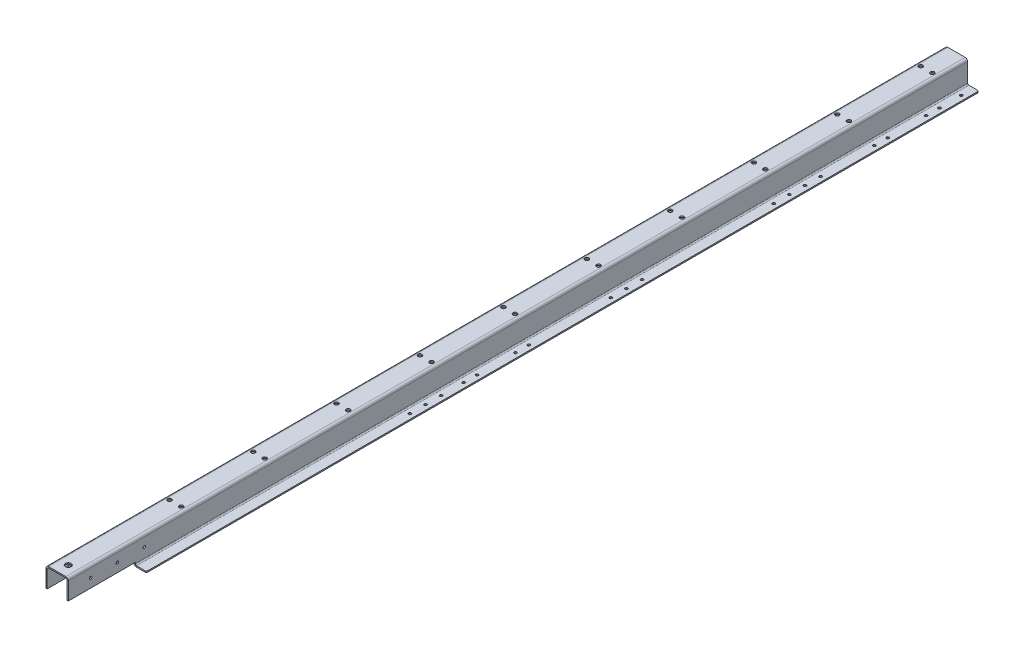
from build123d import *

# Parameters (mm, degrees)
BASE_FLANGE1_DEPTH  = 2015
SKETCH10_W          = 100
SKETCH10_H          = 150
CUT_EXTRUDE4_DEPTH  = 8
CUT_EXTRUDE5_REACH  = 2018.312
SKETCH11_R          = 4.5
SKETCH11_R_2        = 6.5
CUT_EXTRUDE6_REACH  = 2019.015
SKETCH12_R          = 3
CUT_EXTRUDE8_REACH  = 2018.24
SKETCH14_R          = 3
CUT_EXTRUDE9_REACH  = 2018.24
SKETCH15_R          = 3
FILLET1_R           = 3
CUT_EXTRUDE10_REACH = 2018.24
SKETCH17_R          = 3


# Sheet-metal steps are written as plain solids
with BuildPart() as part:
    # Sketch1 → Base-Flange1 (new body)
    with BuildSketch(Plane.XY):
        with BuildLine():
            Line((-50, 0), (-27.8, 0))
            ThreePointArc((-27.8, 0), (-25.820101013, 0.820101013), (-25, 2.8))
            Line((-25, 2.8), (-25, 44.4))
            ThreePointArc((-25, 44.4), (-23.359797975, 48.359797975), (-19.4, 50))
            Line((-19.4, 50), (19.4, 50))
            ThreePointArc((19.4, 50), (23.359797975, 48.359797975), (25, 44.4))
            Line((25, 44.4), (25, 2.8))
            ThreePointArc((25, 2.8), (25.820101013, 0.820101013), (27.8, 0))
            Line((27.8, 0), (50, 0))
            Line((50, 0), (50, -2.8))
            Line((50, -2.8), (27.8, -2.8))
            ThreePointArc((27.8, -2.8), (23.840202025, -1.159797975), (22.2, 2.8))
            Line((22.2, 2.8), (22.2, 44.4))
            ThreePointArc((22.2, 44.4), (21.379898987, 46.379898987), (19.4, 47.2))
            Line((19.4, 47.2), (-19.4, 47.2))
            ThreePointArc((-19.4, 47.2), (-21.379898987, 46.379898987), (-22.2, 44.4))
            Line((-22.2, 44.4), (-22.2, 2.8))
            ThreePointArc((-22.2, 2.8), (-23.840202025, -1.159797975), (-27.8, -2.8))
            Line((-27.8, -2.8), (-50, -2.8))
            Line((-50, -2.8), (-50, 0))
        make_face()
    extrude(amount=BASE_FLANGE1_DEPTH)

    # Sketch10 → Cut-Extrude4 (cut)
    with BuildSketch(Plane.XZ.offset(2.8)):
        with Locations((0, 1940)):
            Rectangle(SKETCH10_W, SKETCH10_H)
    extrude(amount=-CUT_EXTRUDE4_DEPTH, mode=Mode.SUBTRACT)

    # Sketch11 → Cut-Extrude5 (cut, up to next)
    with BuildSketch(Plane(origin=(0, 50, 0), x_dir=(1, 0, 0), z_dir=(0, 1, 0)), mode=Mode.PRIVATE) as cut_extrude5_sk1:
        with Locations(Location((13, -67, 0), (0, 0, 270))):
            Circle(SKETCH11_R)
    cut_extrude5_tool1 = extrude(cut_extrude5_sk1.sketch, amount=-CUT_EXTRUDE5_REACH, mode=Mode.PRIVATE) & part.part
    # Sketch11 → Cut-Extrude5 (cut, up to next)
    with BuildSketch(Plane(origin=(0, 50, 0), x_dir=(1, 0, 0), z_dir=(0, 1, 0)), mode=Mode.PRIVATE) as cut_extrude5_sk2:
        with Locations(Location((-13, -67, 0), (0, 0, 90))):
            Circle(SKETCH11_R)
    cut_extrude5_tool2 = extrude(cut_extrude5_sk2.sketch, amount=-CUT_EXTRUDE5_REACH, mode=Mode.PRIVATE) & part.part
    # Sketch11 → Cut-Extrude5 (cut, up to next)
    with BuildSketch(Plane(origin=(0, 50, 0), x_dir=(1, 0, 0), z_dir=(0, 1, 0)), mode=Mode.PRIVATE) as cut_extrude5_sk3:
        with Locations(Location((13, -254, 0), (0, 0, 270))):
            Circle(SKETCH11_R)
    cut_extrude5_tool3 = extrude(cut_extrude5_sk3.sketch, amount=-CUT_EXTRUDE5_REACH, mode=Mode.PRIVATE) & part.part
    # Sketch11 → Cut-Extrude5 (cut, up to next)
    with BuildSketch(Plane(origin=(0, 50, 0), x_dir=(1, 0, 0), z_dir=(0, 1, 0)), mode=Mode.PRIVATE) as cut_extrude5_sk4:
        with Locations(Location((-13, -254, 0), (0, 0, 90))):
            Circle(SKETCH11_R)
    cut_extrude5_tool4 = extrude(cut_extrude5_sk4.sketch, amount=-CUT_EXTRUDE5_REACH, mode=Mode.PRIVATE) & part.part
    # Sketch11 → Cut-Extrude5 (cut, up to next)
    with BuildSketch(Plane(origin=(0, 50, 0), x_dir=(1, 0, 0), z_dir=(0, 1, 0)), mode=Mode.PRIVATE) as cut_extrude5_sk5:
        with Locations(Location((13, -441, 0), (0, 0, 270))):
            Circle(SKETCH11_R)
    cut_extrude5_tool5 = extrude(cut_extrude5_sk5.sketch, amount=-CUT_EXTRUDE5_REACH, mode=Mode.PRIVATE) & part.part
    # Sketch11 → Cut-Extrude5 (cut, up to next)
    with BuildSketch(Plane(origin=(0, 50, 0), x_dir=(1, 0, 0), z_dir=(0, 1, 0)), mode=Mode.PRIVATE) as cut_extrude5_sk6:
        with Locations(Location((-13, -441, 0), (0, 0, 90))):
            Circle(SKETCH11_R)
    cut_extrude5_tool6 = extrude(cut_extrude5_sk6.sketch, amount=-CUT_EXTRUDE5_REACH, mode=Mode.PRIVATE) & part.part
    # Sketch11 → Cut-Extrude5 (cut, up to next)
    with BuildSketch(Plane(origin=(0, 50, 0), x_dir=(1, 0, 0), z_dir=(0, 1, 0)), mode=Mode.PRIVATE) as cut_extrude5_sk7:
        with Locations(Location((13, -628, 0), (0, 0, 270))):
            Circle(SKETCH11_R)
    cut_extrude5_tool7 = extrude(cut_extrude5_sk7.sketch, amount=-CUT_EXTRUDE5_REACH, mode=Mode.PRIVATE) & part.part
    # Sketch11 → Cut-Extrude5 (cut, up to next)
    with BuildSketch(Plane(origin=(0, 50, 0), x_dir=(1, 0, 0), z_dir=(0, 1, 0)), mode=Mode.PRIVATE) as cut_extrude5_sk8:
        with Locations(Location((-13, -628, 0), (0, 0, 90))):
            Circle(SKETCH11_R)
    cut_extrude5_tool8 = extrude(cut_extrude5_sk8.sketch, amount=-CUT_EXTRUDE5_REACH, mode=Mode.PRIVATE) & part.part
    # Sketch11 → Cut-Extrude5 (cut, up to next)
    with BuildSketch(Plane(origin=(0, 50, 0), x_dir=(1, 0, 0), z_dir=(0, 1, 0)), mode=Mode.PRIVATE) as cut_extrude5_sk9:
        with Locations(Location((13, -815, 0), (0, 0, 270))):
            Circle(SKETCH11_R)
    cut_extrude5_tool9 = extrude(cut_extrude5_sk9.sketch, amount=-CUT_EXTRUDE5_REACH, mode=Mode.PRIVATE) & part.part
    # Sketch11 → Cut-Extrude5 (cut, up to next)
    with BuildSketch(Plane(origin=(0, 50, 0), x_dir=(1, 0, 0), z_dir=(0, 1, 0)), mode=Mode.PRIVATE) as cut_extrude5_sk10:
        with Locations(Location((-13, -815, 0), (0, 0, 90))):
            Circle(SKETCH11_R)
    cut_extrude5_tool10 = extrude(cut_extrude5_sk10.sketch, amount=-CUT_EXTRUDE5_REACH, mode=Mode.PRIVATE) & part.part
    # Sketch11 → Cut-Extrude5 (cut, up to next)
    with BuildSketch(Plane(origin=(0, 50, 0), x_dir=(1, 0, 0), z_dir=(0, 1, 0)), mode=Mode.PRIVATE) as cut_extrude5_sk11:
        with Locations(Location((13, -1002, 0), (0, 0, 270))):
            Circle(SKETCH11_R)
    cut_extrude5_tool11 = extrude(cut_extrude5_sk11.sketch, amount=-CUT_EXTRUDE5_REACH, mode=Mode.PRIVATE) & part.part
    # Sketch11 → Cut-Extrude5 (cut, up to next)
    with BuildSketch(Plane(origin=(0, 50, 0), x_dir=(1, 0, 0), z_dir=(0, 1, 0)), mode=Mode.PRIVATE) as cut_extrude5_sk12:
        with Locations(Location((-13, -1002, 0), (0, 0, 90))):
            Circle(SKETCH11_R)
    cut_extrude5_tool12 = extrude(cut_extrude5_sk12.sketch, amount=-CUT_EXTRUDE5_REACH, mode=Mode.PRIVATE) & part.part
    # Sketch11 → Cut-Extrude5 (cut, up to next)
    with BuildSketch(Plane(origin=(0, 50, 0), x_dir=(1, 0, 0), z_dir=(0, 1, 0)), mode=Mode.PRIVATE) as cut_extrude5_sk13:
        with Locations(Location((13, -1189, 0), (0, 0, 270))):
            Circle(SKETCH11_R)
    cut_extrude5_tool13 = extrude(cut_extrude5_sk13.sketch, amount=-CUT_EXTRUDE5_REACH, mode=Mode.PRIVATE) & part.part
    # Sketch11 → Cut-Extrude5 (cut, up to next)
    with BuildSketch(Plane(origin=(0, 50, 0), x_dir=(1, 0, 0), z_dir=(0, 1, 0)), mode=Mode.PRIVATE) as cut_extrude5_sk14:
        with Locations(Location((-13, -1189, 0), (0, 0, 90))):
            Circle(SKETCH11_R)
    cut_extrude5_tool14 = extrude(cut_extrude5_sk14.sketch, amount=-CUT_EXTRUDE5_REACH, mode=Mode.PRIVATE) & part.part
    # Sketch11 → Cut-Extrude5 (cut, up to next)
    with BuildSketch(Plane(origin=(0, 50, 0), x_dir=(1, 0, 0), z_dir=(0, 1, 0)), mode=Mode.PRIVATE) as cut_extrude5_sk15:
        with Locations(Location((13, -1376, 0), (0, 0, 270))):
            Circle(SKETCH11_R)
    cut_extrude5_tool15 = extrude(cut_extrude5_sk15.sketch, amount=-CUT_EXTRUDE5_REACH, mode=Mode.PRIVATE) & part.part
    # Sketch11 → Cut-Extrude5 (cut, up to next)
    with BuildSketch(Plane(origin=(0, 50, 0), x_dir=(1, 0, 0), z_dir=(0, 1, 0)), mode=Mode.PRIVATE) as cut_extrude5_sk16:
        with Locations(Location((-13, -1376, 0), (0, 0, 90))):
            Circle(SKETCH11_R)
    cut_extrude5_tool16 = extrude(cut_extrude5_sk16.sketch, amount=-CUT_EXTRUDE5_REACH, mode=Mode.PRIVATE) & part.part
    # Sketch11 → Cut-Extrude5 (cut, up to next)
    with BuildSketch(Plane(origin=(0, 50, 0), x_dir=(1, 0, 0), z_dir=(0, 1, 0)), mode=Mode.PRIVATE) as cut_extrude5_sk17:
        with Locations(Location((13, -1563, 0), (0, 0, 270))):
            Circle(SKETCH11_R)
    cut_extrude5_tool17 = extrude(cut_extrude5_sk17.sketch, amount=-CUT_EXTRUDE5_REACH, mode=Mode.PRIVATE) & part.part
    # Sketch11 → Cut-Extrude5 (cut, up to next)
    with BuildSketch(Plane(origin=(0, 50, 0), x_dir=(1, 0, 0), z_dir=(0, 1, 0)), mode=Mode.PRIVATE) as cut_extrude5_sk18:
        with Locations(Location((-13, -1563, 0), (0, 0, 90))):
            Circle(SKETCH11_R)
    cut_extrude5_tool18 = extrude(cut_extrude5_sk18.sketch, amount=-CUT_EXTRUDE5_REACH, mode=Mode.PRIVATE) & part.part
    # Sketch11 → Cut-Extrude5 (cut, up to next)
    with BuildSketch(Plane(origin=(0, 50, 0), x_dir=(1, 0, 0), z_dir=(0, 1, 0)), mode=Mode.PRIVATE) as cut_extrude5_sk19:
        with Locations(Location((13, -1750, 0), (0, 0, 270))):
            Circle(SKETCH11_R)
    cut_extrude5_tool19 = extrude(cut_extrude5_sk19.sketch, amount=-CUT_EXTRUDE5_REACH, mode=Mode.PRIVATE) & part.part
    # Sketch11 → Cut-Extrude5 (cut, up to next)
    with BuildSketch(Plane(origin=(0, 50, 0), x_dir=(1, 0, 0), z_dir=(0, 1, 0)), mode=Mode.PRIVATE) as cut_extrude5_sk20:
        with Locations(Location((-13, -1750, 0), (0, 0, 90))):
            Circle(SKETCH11_R)
    cut_extrude5_tool20 = extrude(cut_extrude5_sk20.sketch, amount=-CUT_EXTRUDE5_REACH, mode=Mode.PRIVATE) & part.part
    # Sketch11 → Cut-Extrude5 (cut, up to next)
    with BuildSketch(Plane(origin=(0, 50, 0), x_dir=(1, 0, 0), z_dir=(0, 1, 0)), mode=Mode.PRIVATE) as cut_extrude5_sk21:
        with Locations(Location((0, -1990, 0), (0, 0, 270))):
            Circle(SKETCH11_R_2)
    cut_extrude5_tool21 = extrude(cut_extrude5_sk21.sketch, amount=-CUT_EXTRUDE5_REACH, mode=Mode.PRIVATE) & part.part
    add(cut_extrude5_tool1.solids().sort_by_distance((13, 50, 67))[0], mode=Mode.SUBTRACT)
    add(cut_extrude5_tool2.solids().sort_by_distance((-13, 50, 67))[0], mode=Mode.SUBTRACT)
    add(cut_extrude5_tool3.solids().sort_by_distance((13, 50, 254))[0], mode=Mode.SUBTRACT)
    add(cut_extrude5_tool4.solids().sort_by_distance((-13, 50, 254))[0], mode=Mode.SUBTRACT)
    add(cut_extrude5_tool5.solids().sort_by_distance((13, 50, 441))[0], mode=Mode.SUBTRACT)
    add(cut_extrude5_tool6.solids().sort_by_distance((-13, 50, 441))[0], mode=Mode.SUBTRACT)
    add(cut_extrude5_tool7.solids().sort_by_distance((13, 50, 628))[0], mode=Mode.SUBTRACT)
    add(cut_extrude5_tool8.solids().sort_by_distance((-13, 50, 628))[0], mode=Mode.SUBTRACT)
    add(cut_extrude5_tool9.solids().sort_by_distance((13, 50, 815))[0], mode=Mode.SUBTRACT)
    add(cut_extrude5_tool10.solids().sort_by_distance((-13, 50, 815))[0], mode=Mode.SUBTRACT)
    add(cut_extrude5_tool11.solids().sort_by_distance((13, 50, 1002))[0], mode=Mode.SUBTRACT)
    add(cut_extrude5_tool12.solids().sort_by_distance((-13, 50, 1002))[0], mode=Mode.SUBTRACT)
    add(cut_extrude5_tool13.solids().sort_by_distance((13, 50, 1189))[0], mode=Mode.SUBTRACT)
    add(cut_extrude5_tool14.solids().sort_by_distance((-13, 50, 1189))[0], mode=Mode.SUBTRACT)
    add(cut_extrude5_tool15.solids().sort_by_distance((13, 50, 1376))[0], mode=Mode.SUBTRACT)
    add(cut_extrude5_tool16.solids().sort_by_distance((-13, 50, 1376))[0], mode=Mode.SUBTRACT)
    add(cut_extrude5_tool17.solids().sort_by_distance((13, 50, 1563))[0], mode=Mode.SUBTRACT)
    add(cut_extrude5_tool18.solids().sort_by_distance((-13, 50, 1563))[0], mode=Mode.SUBTRACT)
    add(cut_extrude5_tool19.solids().sort_by_distance((13, 50, 1750))[0], mode=Mode.SUBTRACT)
    add(cut_extrude5_tool20.solids().sort_by_distance((-13, 50, 1750))[0], mode=Mode.SUBTRACT)
    add(cut_extrude5_tool21.solids().sort_by_distance((0, 50, 1990))[0], mode=Mode.SUBTRACT)

    # Cut-Extrude6: up to this face of the body (flat: up to its plane)
    cut_extrude6_end = Plane(part.part.faces().sort_by_distance((-25, 23.684539442, 1003.477906642))[0])
    # Sketch12 → Cut-Extrude6 (cut, up to the picked face)
    with BuildSketch(Plane(origin=(25, 0, 0), x_dir=(0, 0, -1), z_dir=(1, 0, 0)), mode=Mode.PRIVATE) as cut_extrude6_sk1:
        with Locations((-1965, 25)):
            Circle(SKETCH12_R)
    cut_extrude6_tool1 = split(extrude(cut_extrude6_sk1.sketch, amount=-CUT_EXTRUDE6_REACH, mode=Mode.PRIVATE), bisect_by=cut_extrude6_end, keep=Keep.BOTH, mode=Mode.PRIVATE)
    # Sketch12 → Cut-Extrude6 (cut, up to the picked face)
    with BuildSketch(Plane(origin=(25, 0, 0), x_dir=(0, 0, -1), z_dir=(1, 0, 0)), mode=Mode.PRIVATE) as cut_extrude6_sk2:
        with Locations((-1905, 25)):
            Circle(SKETCH12_R)
    cut_extrude6_tool2 = split(extrude(cut_extrude6_sk2.sketch, amount=-CUT_EXTRUDE6_REACH, mode=Mode.PRIVATE), bisect_by=cut_extrude6_end, keep=Keep.BOTH, mode=Mode.PRIVATE)
    # Sketch12 → Cut-Extrude6 (cut, up to the picked face)
    with BuildSketch(Plane(origin=(25, 0, 0), x_dir=(0, 0, -1), z_dir=(1, 0, 0)), mode=Mode.PRIVATE) as cut_extrude6_sk3:
        with Locations((-1845, 25)):
            Circle(SKETCH12_R)
    cut_extrude6_tool3 = split(extrude(cut_extrude6_sk3.sketch, amount=-CUT_EXTRUDE6_REACH, mode=Mode.PRIVATE), bisect_by=cut_extrude6_end, keep=Keep.BOTH, mode=Mode.PRIVATE)
    add(cut_extrude6_tool1.solids().sort_by(Axis((25, 25, 1965), (-1, 0, 0)))[0], mode=Mode.SUBTRACT)
    add(cut_extrude6_tool2.solids().sort_by(Axis((25, 25, 1905), (-1, 0, 0)))[0], mode=Mode.SUBTRACT)
    add(cut_extrude6_tool3.solids().sort_by(Axis((25, 25, 1845), (-1, 0, 0)))[0], mode=Mode.SUBTRACT)

    # Sketch14 → Cut-Extrude8 (cut, up to next)
    with BuildSketch(Plane(origin=(0, 0, 0), x_dir=(1, 0, 0), z_dir=(0, 1, 0)), mode=Mode.PRIVATE) as cut_extrude8_sk1:
        with Locations(Location((38.9, -107, 0), (0, 0, 270))):
            Circle(SKETCH14_R)
    cut_extrude8_tool1 = extrude(cut_extrude8_sk1.sketch, amount=-CUT_EXTRUDE8_REACH, mode=Mode.PRIVATE) & part.part
    # Sketch14 → Cut-Extrude8 (cut, up to next)
    with BuildSketch(Plane(origin=(0, 0, 0), x_dir=(1, 0, 0), z_dir=(0, 1, 0)), mode=Mode.PRIVATE) as cut_extrude8_sk2:
        with Locations(Location((38.9, -193, 0), (0, 0, 270))):
            Circle(SKETCH14_R)
    cut_extrude8_tool2 = extrude(cut_extrude8_sk2.sketch, amount=-CUT_EXTRUDE8_REACH, mode=Mode.PRIVATE) & part.part
    # Sketch14 → Cut-Extrude8 (cut, up to next)
    with BuildSketch(Plane(origin=(0, 0, 0), x_dir=(1, 0, 0), z_dir=(0, 1, 0)), mode=Mode.PRIVATE) as cut_extrude8_sk3:
        with Locations(Location((-38.9, -193, 0), (0, 0, 90))):
            Circle(SKETCH14_R)
    cut_extrude8_tool3 = extrude(cut_extrude8_sk3.sketch, amount=-CUT_EXTRUDE8_REACH, mode=Mode.PRIVATE) & part.part
    # Sketch14 → Cut-Extrude8 (cut, up to next)
    with BuildSketch(Plane(origin=(0, 0, 0), x_dir=(1, 0, 0), z_dir=(0, 1, 0)), mode=Mode.PRIVATE) as cut_extrude8_sk4:
        with Locations(Location((-38.9, -107, 0), (0, 0, 90))):
            Circle(SKETCH14_R)
    cut_extrude8_tool4 = extrude(cut_extrude8_sk4.sketch, amount=-CUT_EXTRUDE8_REACH, mode=Mode.PRIVATE) & part.part
    # Sketch14 → Cut-Extrude8 (cut, up to next)
    with BuildSketch(Plane(origin=(0, 0, 0), x_dir=(1, 0, 0), z_dir=(0, 1, 0)), mode=Mode.PRIVATE) as cut_extrude8_sk5:
        with Locations(Location((38.9, -1027, 0), (0, 0, 270))):
            Circle(SKETCH14_R)
    cut_extrude8_tool5 = extrude(cut_extrude8_sk5.sketch, amount=-CUT_EXTRUDE8_REACH, mode=Mode.PRIVATE) & part.part
    # Sketch14 → Cut-Extrude8 (cut, up to next)
    with BuildSketch(Plane(origin=(0, 0, 0), x_dir=(1, 0, 0), z_dir=(0, 1, 0)), mode=Mode.PRIVATE) as cut_extrude8_sk6:
        with Locations(Location((38.9, -1113, 0), (0, 0, 270))):
            Circle(SKETCH14_R)
    cut_extrude8_tool6 = extrude(cut_extrude8_sk6.sketch, amount=-CUT_EXTRUDE8_REACH, mode=Mode.PRIVATE) & part.part
    # Sketch14 → Cut-Extrude8 (cut, up to next)
    with BuildSketch(Plane(origin=(0, 0, 0), x_dir=(1, 0, 0), z_dir=(0, 1, 0)), mode=Mode.PRIVATE) as cut_extrude8_sk7:
        with Locations(Location((-38.9, -1113, 0), (0, 0, 90))):
            Circle(SKETCH14_R)
    cut_extrude8_tool7 = extrude(cut_extrude8_sk7.sketch, amount=-CUT_EXTRUDE8_REACH, mode=Mode.PRIVATE) & part.part
    # Sketch14 → Cut-Extrude8 (cut, up to next)
    with BuildSketch(Plane(origin=(0, 0, 0), x_dir=(1, 0, 0), z_dir=(0, 1, 0)), mode=Mode.PRIVATE) as cut_extrude8_sk8:
        with Locations(Location((-38.9, -1027, 0), (0, 0, 90))):
            Circle(SKETCH14_R)
    cut_extrude8_tool8 = extrude(cut_extrude8_sk8.sketch, amount=-CUT_EXTRUDE8_REACH, mode=Mode.PRIVATE) & part.part
    add(cut_extrude8_tool1.solids().sort_by_distance((38.9, 0, 107))[0], mode=Mode.SUBTRACT)
    add(cut_extrude8_tool2.solids().sort_by_distance((38.9, 0, 193))[0], mode=Mode.SUBTRACT)
    add(cut_extrude8_tool3.solids().sort_by_distance((-38.9, 0, 193))[0], mode=Mode.SUBTRACT)
    add(cut_extrude8_tool4.solids().sort_by_distance((-38.9, 0, 107))[0], mode=Mode.SUBTRACT)
    add(cut_extrude8_tool5.solids().sort_by_distance((38.9, 0, 1027))[0], mode=Mode.SUBTRACT)
    add(cut_extrude8_tool6.solids().sort_by_distance((38.9, 0, 1113))[0], mode=Mode.SUBTRACT)
    add(cut_extrude8_tool7.solids().sort_by_distance((-38.9, 0, 1113))[0], mode=Mode.SUBTRACT)
    add(cut_extrude8_tool8.solids().sort_by_distance((-38.9, 0, 1027))[0], mode=Mode.SUBTRACT)

    # Sketch15 → Cut-Extrude9 (cut, up to next)
    with BuildSketch(Plane(origin=(0, 0, 0), x_dir=(1, 0, 0), z_dir=(0, 1, 0)), mode=Mode.PRIVATE) as cut_extrude9_sk1:
        with Locations(Location((38.9, -28.22, 0), (0, 0, 270))):
            Circle(SKETCH15_R)
    cut_extrude9_tool1 = extrude(cut_extrude9_sk1.sketch, amount=-CUT_EXTRUDE9_REACH, mode=Mode.PRIVATE) & part.part
    # Sketch15 → Cut-Extrude9 (cut, up to next)
    with BuildSketch(Plane(origin=(0, 0, 0), x_dir=(1, 0, 0), z_dir=(0, 1, 0)), mode=Mode.PRIVATE) as cut_extrude9_sk2:
        with Locations(Location((-38.9, -28.22, 0), (0, 0, 90))):
            Circle(SKETCH15_R)
    cut_extrude9_tool2 = extrude(cut_extrude9_sk2.sketch, amount=-CUT_EXTRUDE9_REACH, mode=Mode.PRIVATE) & part.part
    # Sketch15 → Cut-Extrude9 (cut, up to next)
    with BuildSketch(Plane(origin=(0, 0, 0), x_dir=(1, 0, 0), z_dir=(0, 1, 0)), mode=Mode.PRIVATE) as cut_extrude9_sk3:
        with Locations(Location((38.9, -378.39, 0), (0, 0, 270))):
            Circle(SKETCH15_R)
    cut_extrude9_tool3 = extrude(cut_extrude9_sk3.sketch, amount=-CUT_EXTRUDE9_REACH, mode=Mode.PRIVATE) & part.part
    # Sketch15 → Cut-Extrude9 (cut, up to next)
    with BuildSketch(Plane(origin=(0, 0, 0), x_dir=(1, 0, 0), z_dir=(0, 1, 0)), mode=Mode.PRIVATE) as cut_extrude9_sk4:
        with Locations(Location((-38.9, -378.39, 0), (0, 0, 90))):
            Circle(SKETCH15_R)
    cut_extrude9_tool4 = extrude(cut_extrude9_sk4.sketch, amount=-CUT_EXTRUDE9_REACH, mode=Mode.PRIVATE) & part.part
    # Sketch15 → Cut-Extrude9 (cut, up to next)
    with BuildSketch(Plane(origin=(0, 0, 0), x_dir=(1, 0, 0), z_dir=(0, 1, 0)), mode=Mode.PRIVATE) as cut_extrude9_sk5:
        with Locations(Location((38.9, -778.44, 0), (0, 0, 270))):
            Circle(SKETCH15_R)
    cut_extrude9_tool5 = extrude(cut_extrude9_sk5.sketch, amount=-CUT_EXTRUDE9_REACH, mode=Mode.PRIVATE) & part.part
    # Sketch15 → Cut-Extrude9 (cut, up to next)
    with BuildSketch(Plane(origin=(0, 0, 0), x_dir=(1, 0, 0), z_dir=(0, 1, 0)), mode=Mode.PRIVATE) as cut_extrude9_sk6:
        with Locations(Location((-38.9, -778.44, 0), (0, 0, 90))):
            Circle(SKETCH15_R)
    cut_extrude9_tool6 = extrude(cut_extrude9_sk6.sketch, amount=-CUT_EXTRUDE9_REACH, mode=Mode.PRIVATE) & part.part
    # Sketch15 → Cut-Extrude9 (cut, up to next)
    with BuildSketch(Plane(origin=(0, 0, 0), x_dir=(1, 0, 0), z_dir=(0, 1, 0)), mode=Mode.PRIVATE) as cut_extrude9_sk7:
        with Locations(Location((38.9, -1228.56, 0), (0, 0, 270))):
            Circle(SKETCH15_R)
    cut_extrude9_tool7 = extrude(cut_extrude9_sk7.sketch, amount=-CUT_EXTRUDE9_REACH, mode=Mode.PRIVATE) & part.part
    # Sketch15 → Cut-Extrude9 (cut, up to next)
    with BuildSketch(Plane(origin=(0, 0, 0), x_dir=(1, 0, 0), z_dir=(0, 1, 0)), mode=Mode.PRIVATE) as cut_extrude9_sk8:
        with Locations(Location((-38.9, -1228.56, 0), (0, 0, 90))):
            Circle(SKETCH15_R)
    cut_extrude9_tool8 = extrude(cut_extrude9_sk8.sketch, amount=-CUT_EXTRUDE9_REACH, mode=Mode.PRIVATE) & part.part
    add(cut_extrude9_tool1.solids().sort_by_distance((38.9, 0, 28.22))[0], mode=Mode.SUBTRACT)
    add(cut_extrude9_tool2.solids().sort_by_distance((-38.9, 0, 28.22))[0], mode=Mode.SUBTRACT)
    add(cut_extrude9_tool3.solids().sort_by_distance((38.9, 0, 378.39))[0], mode=Mode.SUBTRACT)
    add(cut_extrude9_tool4.solids().sort_by_distance((-38.9, 0, 378.39))[0], mode=Mode.SUBTRACT)
    add(cut_extrude9_tool5.solids().sort_by_distance((38.9, 0, 778.44))[0], mode=Mode.SUBTRACT)
    add(cut_extrude9_tool6.solids().sort_by_distance((-38.9, 0, 778.44))[0], mode=Mode.SUBTRACT)
    add(cut_extrude9_tool7.solids().sort_by_distance((38.9, 0, 1228.56))[0], mode=Mode.SUBTRACT)
    add(cut_extrude9_tool8.solids().sort_by_distance((-38.9, 0, 1228.56))[0], mode=Mode.SUBTRACT)

    # Fillet1
    fillet1_edges = [part.edges().sort_by_distance(p)[0] for p in [
        (50, -1.4, 0),
        (-50, -1.4, 0),
        (50, -1.4, 1865),
        (-50, -1.4, 1865),
    ]]
    fillet(fillet1_edges, radius=FILLET1_R)

    # Sketch17 → Cut-Extrude10 (cut, up to next)
    with BuildSketch(Plane(origin=(0, 0, 0), x_dir=(1, 0, 0), z_dir=(0, 1, 0)), mode=Mode.PRIVATE) as cut_extrude10_sk1:
        with Locations(Location((38.9, -77, 0), (0, 0, 270))):
            Circle(SKETCH17_R)
    cut_extrude10_tool1 = extrude(cut_extrude10_sk1.sketch, amount=-CUT_EXTRUDE10_REACH, mode=Mode.PRIVATE) & part.part
    # Sketch17 → Cut-Extrude10 (cut, up to next)
    with BuildSketch(Plane(origin=(0, 0, 0), x_dir=(1, 0, 0), z_dir=(0, 1, 0)), mode=Mode.PRIVATE) as cut_extrude10_sk2:
        with Locations(Location((38.9, -223, 0), (0, 0, 270))):
            Circle(SKETCH17_R)
    cut_extrude10_tool2 = extrude(cut_extrude10_sk2.sketch, amount=-CUT_EXTRUDE10_REACH, mode=Mode.PRIVATE) & part.part
    # Sketch17 → Cut-Extrude10 (cut, up to next)
    with BuildSketch(Plane(origin=(0, 0, 0), x_dir=(1, 0, 0), z_dir=(0, 1, 0)), mode=Mode.PRIVATE) as cut_extrude10_sk3:
        with Locations(Location((38.9, -343.39, 0), (0, 0, 270))):
            Circle(SKETCH17_R)
    cut_extrude10_tool3 = extrude(cut_extrude10_sk3.sketch, amount=-CUT_EXTRUDE10_REACH, mode=Mode.PRIVATE) & part.part
    # Sketch17 → Cut-Extrude10 (cut, up to next)
    with BuildSketch(Plane(origin=(0, 0, 0), x_dir=(1, 0, 0), z_dir=(0, 1, 0)), mode=Mode.PRIVATE) as cut_extrude10_sk4:
        with Locations(Location((38.9, -413.39, 0), (0, 0, 270))):
            Circle(SKETCH17_R)
    cut_extrude10_tool4 = extrude(cut_extrude10_sk4.sketch, amount=-CUT_EXTRUDE10_REACH, mode=Mode.PRIVATE) & part.part
    # Sketch17 → Cut-Extrude10 (cut, up to next)
    with BuildSketch(Plane(origin=(0, 0, 0), x_dir=(1, 0, 0), z_dir=(0, 1, 0)), mode=Mode.PRIVATE) as cut_extrude10_sk5:
        with Locations(Location((38.9, -743.44, 0), (0, 0, 270))):
            Circle(SKETCH17_R)
    cut_extrude10_tool5 = extrude(cut_extrude10_sk5.sketch, amount=-CUT_EXTRUDE10_REACH, mode=Mode.PRIVATE) & part.part
    # Sketch17 → Cut-Extrude10 (cut, up to next)
    with BuildSketch(Plane(origin=(0, 0, 0), x_dir=(1, 0, 0), z_dir=(0, 1, 0)), mode=Mode.PRIVATE) as cut_extrude10_sk6:
        with Locations(Location((38.9, -813.44, 0), (0, 0, 270))):
            Circle(SKETCH17_R)
    cut_extrude10_tool6 = extrude(cut_extrude10_sk6.sketch, amount=-CUT_EXTRUDE10_REACH, mode=Mode.PRIVATE) & part.part
    # Sketch17 → Cut-Extrude10 (cut, up to next)
    with BuildSketch(Plane(origin=(0, 0, 0), x_dir=(1, 0, 0), z_dir=(0, 1, 0)), mode=Mode.PRIVATE) as cut_extrude10_sk7:
        with Locations(Location((38.9, -997, 0), (0, 0, 270))):
            Circle(SKETCH17_R)
    cut_extrude10_tool7 = extrude(cut_extrude10_sk7.sketch, amount=-CUT_EXTRUDE10_REACH, mode=Mode.PRIVATE) & part.part
    # Sketch17 → Cut-Extrude10 (cut, up to next)
    with BuildSketch(Plane(origin=(0, 0, 0), x_dir=(1, 0, 0), z_dir=(0, 1, 0)), mode=Mode.PRIVATE) as cut_extrude10_sk8:
        with Locations(Location((38.9, -1143, 0), (0, 0, 270))):
            Circle(SKETCH17_R)
    cut_extrude10_tool8 = extrude(cut_extrude10_sk8.sketch, amount=-CUT_EXTRUDE10_REACH, mode=Mode.PRIVATE) & part.part
    # Sketch17 → Cut-Extrude10 (cut, up to next)
    with BuildSketch(Plane(origin=(0, 0, 0), x_dir=(1, 0, 0), z_dir=(0, 1, 0)), mode=Mode.PRIVATE) as cut_extrude10_sk9:
        with Locations(Location((38.9, -1193.56, 0), (0, 0, 270))):
            Circle(SKETCH17_R)
    cut_extrude10_tool9 = extrude(cut_extrude10_sk9.sketch, amount=-CUT_EXTRUDE10_REACH, mode=Mode.PRIVATE) & part.part
    # Sketch17 → Cut-Extrude10 (cut, up to next)
    with BuildSketch(Plane(origin=(0, 0, 0), x_dir=(1, 0, 0), z_dir=(0, 1, 0)), mode=Mode.PRIVATE) as cut_extrude10_sk10:
        with Locations(Location((38.9, -1263.56, 0), (0, 0, 270))):
            Circle(SKETCH17_R)
    cut_extrude10_tool10 = extrude(cut_extrude10_sk10.sketch, amount=-CUT_EXTRUDE10_REACH, mode=Mode.PRIVATE) & part.part
    # Sketch17 → Cut-Extrude10 (cut, up to next)
    with BuildSketch(Plane(origin=(0, 0, 0), x_dir=(1, 0, 0), z_dir=(0, 1, 0)), mode=Mode.PRIVATE) as cut_extrude10_sk11:
        with Locations(Location((-38.9, -1263.56, 0), (0, 0, 90))):
            Circle(SKETCH17_R)
    cut_extrude10_tool11 = extrude(cut_extrude10_sk11.sketch, amount=-CUT_EXTRUDE10_REACH, mode=Mode.PRIVATE) & part.part
    # Sketch17 → Cut-Extrude10 (cut, up to next)
    with BuildSketch(Plane(origin=(0, 0, 0), x_dir=(1, 0, 0), z_dir=(0, 1, 0)), mode=Mode.PRIVATE) as cut_extrude10_sk12:
        with Locations(Location((-38.9, -1193.56, 0), (0, 0, 90))):
            Circle(SKETCH17_R)
    cut_extrude10_tool12 = extrude(cut_extrude10_sk12.sketch, amount=-CUT_EXTRUDE10_REACH, mode=Mode.PRIVATE) & part.part
    # Sketch17 → Cut-Extrude10 (cut, up to next)
    with BuildSketch(Plane(origin=(0, 0, 0), x_dir=(1, 0, 0), z_dir=(0, 1, 0)), mode=Mode.PRIVATE) as cut_extrude10_sk13:
        with Locations(Location((-38.9, -1143, 0), (0, 0, 90))):
            Circle(SKETCH17_R)
    cut_extrude10_tool13 = extrude(cut_extrude10_sk13.sketch, amount=-CUT_EXTRUDE10_REACH, mode=Mode.PRIVATE) & part.part
    # Sketch17 → Cut-Extrude10 (cut, up to next)
    with BuildSketch(Plane(origin=(0, 0, 0), x_dir=(1, 0, 0), z_dir=(0, 1, 0)), mode=Mode.PRIVATE) as cut_extrude10_sk14:
        with Locations(Location((-38.9, -997, 0), (0, 0, 90))):
            Circle(SKETCH17_R)
    cut_extrude10_tool14 = extrude(cut_extrude10_sk14.sketch, amount=-CUT_EXTRUDE10_REACH, mode=Mode.PRIVATE) & part.part
    # Sketch17 → Cut-Extrude10 (cut, up to next)
    with BuildSketch(Plane(origin=(0, 0, 0), x_dir=(1, 0, 0), z_dir=(0, 1, 0)), mode=Mode.PRIVATE) as cut_extrude10_sk15:
        with Locations(Location((-38.9, -813.44, 0), (0, 0, 90))):
            Circle(SKETCH17_R)
    cut_extrude10_tool15 = extrude(cut_extrude10_sk15.sketch, amount=-CUT_EXTRUDE10_REACH, mode=Mode.PRIVATE) & part.part
    # Sketch17 → Cut-Extrude10 (cut, up to next)
    with BuildSketch(Plane(origin=(0, 0, 0), x_dir=(1, 0, 0), z_dir=(0, 1, 0)), mode=Mode.PRIVATE) as cut_extrude10_sk16:
        with Locations(Location((-38.9, -743.44, 0), (0, 0, 90))):
            Circle(SKETCH17_R)
    cut_extrude10_tool16 = extrude(cut_extrude10_sk16.sketch, amount=-CUT_EXTRUDE10_REACH, mode=Mode.PRIVATE) & part.part
    # Sketch17 → Cut-Extrude10 (cut, up to next)
    with BuildSketch(Plane(origin=(0, 0, 0), x_dir=(1, 0, 0), z_dir=(0, 1, 0)), mode=Mode.PRIVATE) as cut_extrude10_sk17:
        with Locations(Location((-38.9, -413.39, 0), (0, 0, 90))):
            Circle(SKETCH17_R)
    cut_extrude10_tool17 = extrude(cut_extrude10_sk17.sketch, amount=-CUT_EXTRUDE10_REACH, mode=Mode.PRIVATE) & part.part
    # Sketch17 → Cut-Extrude10 (cut, up to next)
    with BuildSketch(Plane(origin=(0, 0, 0), x_dir=(1, 0, 0), z_dir=(0, 1, 0)), mode=Mode.PRIVATE) as cut_extrude10_sk18:
        with Locations(Location((-38.9, -343.39, 0), (0, 0, 90))):
            Circle(SKETCH17_R)
    cut_extrude10_tool18 = extrude(cut_extrude10_sk18.sketch, amount=-CUT_EXTRUDE10_REACH, mode=Mode.PRIVATE) & part.part
    # Sketch17 → Cut-Extrude10 (cut, up to next)
    with BuildSketch(Plane(origin=(0, 0, 0), x_dir=(1, 0, 0), z_dir=(0, 1, 0)), mode=Mode.PRIVATE) as cut_extrude10_sk19:
        with Locations(Location((-38.9, -223, 0), (0, 0, 90))):
            Circle(SKETCH17_R)
    cut_extrude10_tool19 = extrude(cut_extrude10_sk19.sketch, amount=-CUT_EXTRUDE10_REACH, mode=Mode.PRIVATE) & part.part
    # Sketch17 → Cut-Extrude10 (cut, up to next)
    with BuildSketch(Plane(origin=(0, 0, 0), x_dir=(1, 0, 0), z_dir=(0, 1, 0)), mode=Mode.PRIVATE) as cut_extrude10_sk20:
        with Locations(Location((-38.9, -77, 0), (0, 0, 90))):
            Circle(SKETCH17_R)
    cut_extrude10_tool20 = extrude(cut_extrude10_sk20.sketch, amount=-CUT_EXTRUDE10_REACH, mode=Mode.PRIVATE) & part.part
    # Sketch17 → Cut-Extrude10 (cut, up to next)
    with BuildSketch(Plane(origin=(0, 0, 0), x_dir=(1, 0, 0), z_dir=(0, 1, 0)), mode=Mode.PRIVATE) as cut_extrude10_sk21:
        with Locations(Location((38.9, -448.39, 0), (0, 0, 270))):
            Circle(SKETCH17_R)
    cut_extrude10_tool21 = extrude(cut_extrude10_sk21.sketch, amount=-CUT_EXTRUDE10_REACH, mode=Mode.PRIVATE) & part.part
    # Sketch17 → Cut-Extrude10 (cut, up to next)
    with BuildSketch(Plane(origin=(0, 0, 0), x_dir=(1, 0, 0), z_dir=(0, 1, 0)), mode=Mode.PRIVATE) as cut_extrude10_sk22:
        with Locations(Location((-38.9, -448.39, 0), (0, 0, 270))):
            Circle(SKETCH17_R)
    cut_extrude10_tool22 = extrude(cut_extrude10_sk22.sketch, amount=-CUT_EXTRUDE10_REACH, mode=Mode.PRIVATE) & part.part
    add(cut_extrude10_tool1.solids().sort_by_distance((38.9, 0, 77))[0], mode=Mode.SUBTRACT)
    add(cut_extrude10_tool2.solids().sort_by_distance((38.9, 0, 223))[0], mode=Mode.SUBTRACT)
    add(cut_extrude10_tool3.solids().sort_by_distance((38.9, 0, 343.39))[0], mode=Mode.SUBTRACT)
    add(cut_extrude10_tool4.solids().sort_by_distance((38.9, 0, 413.39))[0], mode=Mode.SUBTRACT)
    add(cut_extrude10_tool5.solids().sort_by_distance((38.9, 0, 743.44))[0], mode=Mode.SUBTRACT)
    add(cut_extrude10_tool6.solids().sort_by_distance((38.9, 0, 813.44))[0], mode=Mode.SUBTRACT)
    add(cut_extrude10_tool7.solids().sort_by_distance((38.9, 0, 997))[0], mode=Mode.SUBTRACT)
    add(cut_extrude10_tool8.solids().sort_by_distance((38.9, 0, 1143))[0], mode=Mode.SUBTRACT)
    add(cut_extrude10_tool9.solids().sort_by_distance((38.9, 0, 1193.56))[0], mode=Mode.SUBTRACT)
    add(cut_extrude10_tool10.solids().sort_by_distance((38.9, 0, 1263.56))[0], mode=Mode.SUBTRACT)
    add(cut_extrude10_tool11.solids().sort_by_distance((-38.9, 0, 1263.56))[0], mode=Mode.SUBTRACT)
    add(cut_extrude10_tool12.solids().sort_by_distance((-38.9, 0, 1193.56))[0], mode=Mode.SUBTRACT)
    add(cut_extrude10_tool13.solids().sort_by_distance((-38.9, 0, 1143))[0], mode=Mode.SUBTRACT)
    add(cut_extrude10_tool14.solids().sort_by_distance((-38.9, 0, 997))[0], mode=Mode.SUBTRACT)
    add(cut_extrude10_tool15.solids().sort_by_distance((-38.9, 0, 813.44))[0], mode=Mode.SUBTRACT)
    add(cut_extrude10_tool16.solids().sort_by_distance((-38.9, 0, 743.44))[0], mode=Mode.SUBTRACT)
    add(cut_extrude10_tool17.solids().sort_by_distance((-38.9, 0, 413.39))[0], mode=Mode.SUBTRACT)
    add(cut_extrude10_tool18.solids().sort_by_distance((-38.9, 0, 343.39))[0], mode=Mode.SUBTRACT)
    add(cut_extrude10_tool19.solids().sort_by_distance((-38.9, 0, 223))[0], mode=Mode.SUBTRACT)
    add(cut_extrude10_tool20.solids().sort_by_distance((-38.9, 0, 77))[0], mode=Mode.SUBTRACT)
    add(cut_extrude10_tool21.solids().sort_by_distance((38.9, 0, 448.39))[0], mode=Mode.SUBTRACT)
    add(cut_extrude10_tool22.solids().sort_by_distance((-38.9, 0, 448.39))[0], mode=Mode.SUBTRACT)


solid = part.part
